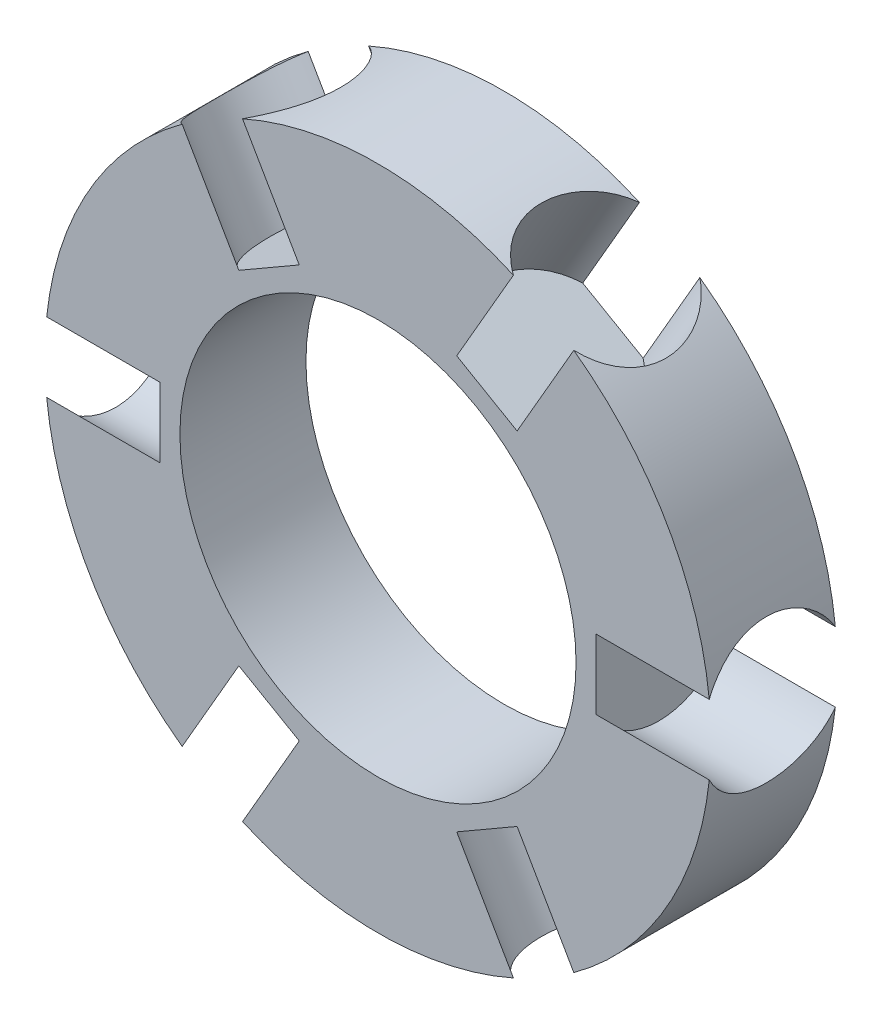
from build123d import *

# Parameters (mm, degrees)
SKETCH1_R           = 18.5
SKETCH1_R_2         = 11
BOSS_EXTRUDE1_DEPTH = 3.5
SKETCH2_R           = 4
CUT_EXTRUDE3_DEPTH  = 6.4
CIRPATTERN1_COUNT   = 6


with BuildPart() as part:
    # Sketch1 → Boss-Extrude1 (new, symmetric)
    with BuildSketch(Plane.XY):
        Circle(SKETCH1_R)
        Circle(SKETCH1_R_2, mode=Mode.SUBTRACT)
    extrude(amount=BOSS_EXTRUDE1_DEPTH, both=True)

    # Sketch2 → Cut-Extrude3 (cut)
    with BuildSketch(Plane(origin=(-18.5, -17.193061184, 0), x_dir=(0, -1, 0), z_dir=(1, 0, 0))):
        with Locations((-17.193061184, 0)):
            Circle(SKETCH2_R)
    cut_extrude3 = extrude(amount=CUT_EXTRUDE3_DEPTH, mode=Mode.SUBTRACT)

    # CirPattern1: Cut-Extrude3 ×6 about axis
    cirpattern1_axis = Axis((0, 0, 3.5), (0, 0, 1))
    for i in range(1, CIRPATTERN1_COUNT):
        add(cut_extrude3.rotate(cirpattern1_axis, i * 360 / CIRPATTERN1_COUNT), mode=Mode.SUBTRACT)


solid = part.part
